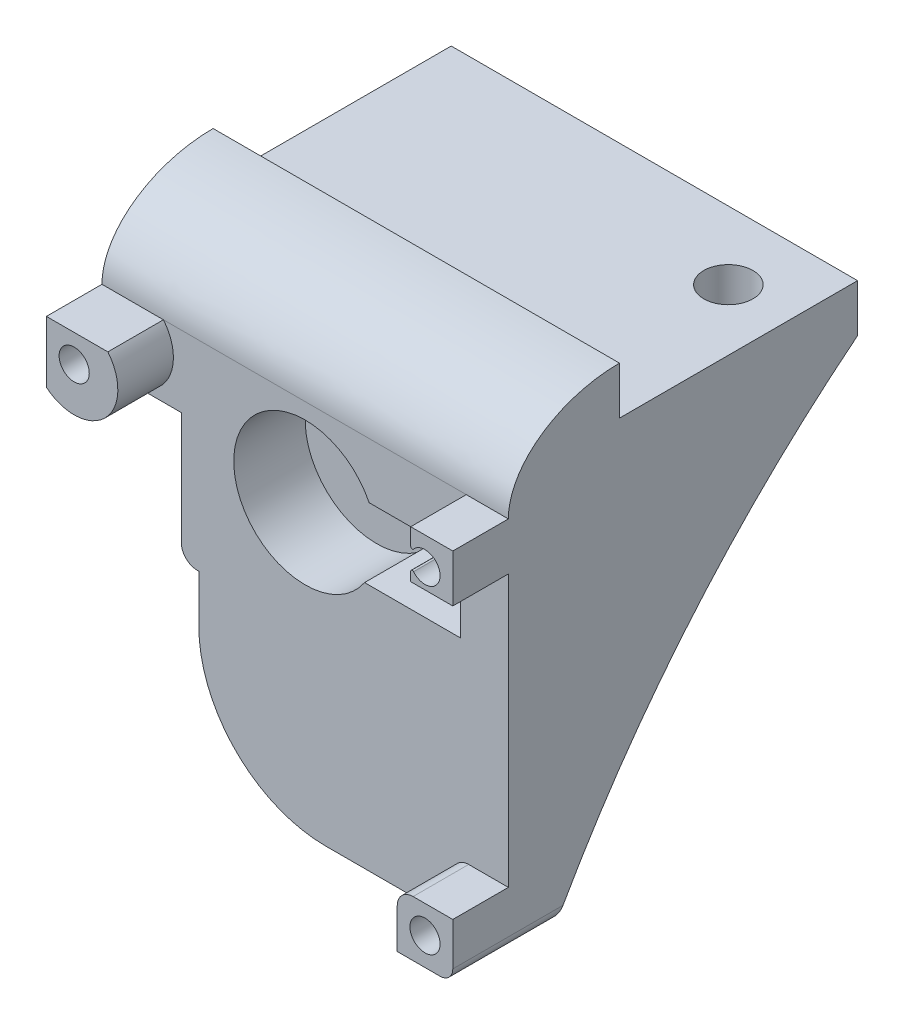
from build123d import *
from build123d.topology import SkipClean

# Parameters (mm, degrees)
BOSS_EXTRUDE1_START     = -15
BOSS_EXTRUDE1_OUTLINE_W = 25.6
BOSS_EXTRUDE1_OUTLINE_H = 3
BOSS_EXTRUDE1_DEPTH     = 15
SKETCH2_4_W             = 25.6
SKETCH2_4_H             = 6
BOSS_EXTRUDE2_DEPTH     = 4
BOSS_EXTRUDE6_START     = 4
SKETCH2_6_R             = 0.95
BOSS_EXTRUDE6_DEPTH     = 3
BOSS_EXTRUDE7_START     = 7
SKETCH2_7_R             = 0.95
BOSS_EXTRUDE7_DEPTH     = 3.5
BOSS_EXTRUDE8_START     = -25.6
BOSS_EXTRUDE8_DEPTH     = 25.6
CUT_EXTRUDE1_REACH      = 130.924
CUT_EXTRUDE1_END_RADIUS = 75
CUT_EXTRUDE2_START      = -1.5
CUT_EXTRUDE2_DEPTH      = 1.5
CUT_EXTRUDE3_REACH      = 87.887
CUT_EXTRUDE4_REACH      = 111.283
CUT_EXTRUDE4_END_RADIUS = 75
SKETCH6_R               = 1.55
CUT_EXTRUDE5_START      = -3
SKETCH6_4_R             = 1.55
CUT_EXTRUDE5_DEPTH      = 2.6
CUT_EXTRUDE6_START      = -1.098342
SKETCH7_W               = 3.1
SKETCH7_H               = 1.207100643
CUT_EXTRUDE6_DEPTH      = 1.098342


# Read off the part's stored shape, not the designer's step: Boss-Extrude1
with BuildPart() as part:
    # Boss-Extrude1 outline → Boss-Extrude1 (new body)
    with BuildSketch(Plane.XY.offset(19.065792005).offset(BOSS_EXTRUDE1_START)):
        with Locations((89.245789569, -52.366374711)):
            Rectangle(BOSS_EXTRUDE1_OUTLINE_W, BOSS_EXTRUDE1_OUTLINE_H)
    extrude(amount=BOSS_EXTRUDE1_DEPTH)

    # Sketch2<4> → Boss-Extrude2 (add)
    with BuildSketch(Plane.XY.offset(19.065792005)):
        with Locations((89.245789569, -50.866374711)):
            Rectangle(SKETCH2_4_W, SKETCH2_4_H)
    extrude(amount=BOSS_EXTRUDE2_DEPTH)

    # Sketch2<6> → Boss-Extrude6 (add)
    with BuildSketch(Plane.XY.offset(19.065792005).offset(BOSS_EXTRUDE6_START)):
        with BuildLine():
            ThreePointArc((76.445789569, -56.737695055), (77.266039857, -57.204436819), (78.195789569, -57.366374711))
            Line((78.195789569, -57.366374711), (81.445789569, -57.366374711))
            Line((81.445789569, -57.366374711), (81.445789569, -64.466374711))
            ThreePointArc((81.445789569, -64.466374711), (81.738682788, -65.173481493), (82.445789569, -65.466374711))
            Line((82.445789569, -65.466374711), (82.545789569, -65.466374711))
            Line((82.545789569, -65.466374711), (82.545789569, -68.466374711))
            ThreePointArc((82.545789569, -68.466374711), (84.88893532, -74.123228961), (90.545789569, -76.466374711))
            Line((90.545789569, -76.466374711), (101.245789569, -76.466374711))
            ThreePointArc((101.245789569, -76.466374711), (101.811474994, -76.232060136), (102.045789569, -75.666374711))
            Line((102.045789569, -75.666374711), (102.045789569, -47.866374711))
            Line((102.045789569, -47.866374711), (76.445789569, -47.866374711))
            Line((76.445789569, -47.866374711), (76.445789569, -56.737695055))
        make_face()
        with Locations(Location((100.295789569, -54.616374711, 0), (0, 0, 127.863646362))):
            Circle(SKETCH2_6_R, mode=Mode.SUBTRACT)
        with Locations(Location((78.195789569, -54.616374711, 0), (0, 0, 127.863646362))):
            Circle(SKETCH2_6_R, mode=Mode.SUBTRACT)
        with BuildLine():
            Line((99.045789569, -56.366374711), (99.045789569, -60.866374711))
            Line((99.045789569, -60.866374711), (92.987446956, -60.866374711))
            ThreePointArc((92.987446956, -60.866374711), (84.75507119, -58.077500283), (93.276918444, -56.366374711))
            Line((93.276918444, -56.366374711), (99.045789569, -56.366374711))
        make_face(mode=Mode.SUBTRACT)
        with Locations((100.295789569, -74.716374711)):
            Circle(SKETCH2_6_R, mode=Mode.SUBTRACT)
    extrude(amount=BOSS_EXTRUDE6_DEPTH)

    # Sketch2<7> → Boss-Extrude7 (add)
    # profile 1 of 6: a face of its own
    with SkipClean():  # the faces are left unmerged after this step: merging them gives an invalid solid
        with BuildSketch(Plane.XY.offset(19.065792005).offset(BOSS_EXTRUDE7_START)):
            with BuildLine():
                ThreePointArc((78.195789569, -57.366374711), (80.389530666, -56.274687107), (80.84154088, -53.866374711))
                Line((80.84154088, -53.866374711), (78.778884759, -53.866374711))
                ThreePointArc((78.778884759, -53.866374711), (79.049147768, -54.198906407), (79.145789569, -54.616374711))
                ThreePointArc((79.145789569, -54.616374711), (77.778321265, -55.46973291), (77.61269438, -53.866374711))
                Line((77.61269438, -53.866374711), (76.445789569, -53.866374711))
                Line((76.445789569, -53.866374711), (76.445789569, -56.737695055))
                ThreePointArc((76.445789569, -56.737695055), (77.266039857, -57.204436819), (78.195789569, -57.366374711))
            make_face()
        # profile 2 of 6: a face of its own
        with BuildSketch(Plane.XY.offset(19.065792005).offset(BOSS_EXTRUDE7_START)):
            with BuildLine():
                Line((78.778884759, -53.866374711), (80.84154088, -53.866374711))
                ThreePointArc((80.84154088, -53.866374711), (80.631203916, -53.339168009), (80.317109913, -52.866374711))
                Line((80.317109913, -52.866374711), (76.445789569, -52.866374711))
                Line((76.445789569, -52.866374711), (76.445789569, -53.866374711))
                Line((76.445789569, -53.866374711), (77.61269438, -53.866374711))
                ThreePointArc((77.61269438, -53.866374711), (78.195789569, -53.666374711), (78.778884759, -53.866374711))
            make_face()
        # profile 3 of 6: a face of its own
        with BuildSketch(Plane.XY.offset(19.065792005).offset(BOSS_EXTRUDE7_START)):
            with BuildLine():
                Line((102.045789569, -53.866374711), (100.878884759, -53.866374711))
                ThreePointArc((100.878884759, -53.866374711), (101.149147768, -54.198906407), (101.245789569, -54.616374711))
                ThreePointArc((101.245789569, -54.616374711), (100.62357071, -55.508035815), (99.571980046, -55.23167933))
                ThreePointArc((99.571980046, -55.23167933), (99.461286291, -55.202589173), (99.395789569, -55.296448237))
                Line((99.395789569, -55.296448237), (99.395789569, -55.866374711))
                Line((99.395789569, -55.866374711), (102.045789569, -55.866374711))
                Line((102.045789569, -55.866374711), (102.045789569, -53.866374711))
            make_face()
        # profile 4 of 6: a face of its own
        with BuildSketch(Plane.XY.offset(19.065792005).offset(BOSS_EXTRUDE7_START)):
            with BuildLine():
                Line((99.395789569, -52.866374711), (99.395789569, -53.866374711))
                Line((99.395789569, -53.866374711), (99.71269438, -53.866374711))
                ThreePointArc((99.71269438, -53.866374711), (100.295789569, -53.666374711), (100.878884759, -53.866374711))
                Line((100.878884759, -53.866374711), (102.045789569, -53.866374711))
                Line((102.045789569, -53.866374711), (102.045789569, -52.866374711))
                Line((102.045789569, -52.866374711), (99.395789569, -52.866374711))
            make_face()
        # profile 5 of 6: a face of its own
        with BuildSketch(Plane.XY.offset(19.065792005).offset(BOSS_EXTRUDE7_START)):
            with BuildLine():
                Line((99.71269438, -53.866374711), (99.395789569, -53.866374711))
                Line((99.395789569, -53.866374711), (99.395789569, -53.936301186))
                ThreePointArc((99.395789569, -53.936301186), (99.461286291, -54.03016025), (99.571980046, -54.001070093))
                ThreePointArc((99.571980046, -54.001070093), (99.638875805, -53.930106319), (99.71269438, -53.866374711))
            make_face()
        # profile 6 of 6: a face of its own
        with BuildSketch(Plane.XY.offset(19.065792005).offset(BOSS_EXTRUDE7_START)):
            with BuildLine():
                Line((102.045789569, -75.666374711), (102.045789569, -72.966374711))
                Line((102.045789569, -72.966374711), (99.545789569, -72.966374711))
                ThreePointArc((99.545789569, -72.966374711), (98.838682788, -73.25926793), (98.545789569, -73.966374711))
                Line((98.545789569, -73.966374711), (98.545789569, -76.466374711))
                Line((98.545789569, -76.466374711), (101.245789569, -76.466374711))
                ThreePointArc((101.245789569, -76.466374711), (101.811474994, -76.232060136), (102.045789569, -75.666374711))
            make_face()
            with Locations((100.295789569, -74.716374711)):
                Circle(SKETCH2_7_R, mode=Mode.SUBTRACT)
        extrude(amount=BOSS_EXTRUDE7_DEPTH)

    # Sketch3 → Boss-Extrude8 (add)
    with SkipClean():  # the faces are left unmerged after this step: merging them gives an invalid solid
        with BuildSketch(Plane.ZY.offset(-76.445789569).offset(BOSS_EXTRUDE8_START)):
            with BuildLine():
                Line((4.065792005, -53.866374711), (23.065792005, -53.866374711))
                Line((23.065792005, -53.866374711), (23.065792005, -76.466374711))
                ThreePointArc((23.065792005, -76.466374711), (14.688908487, -64.22216174), (4.065792005, -53.866374711))
            make_face()
        extrude(amount=BOSS_EXTRUDE8_DEPTH)

    # Cut-Extrude1: up to this cylinder (the profile starts outside it)
    with SkipClean():  # the faces are left unmerged after this step: merging them gives an invalid solid
        cut_extrude1_end = Plane(origin=(90.860738, -112.485393056, -42.718935079), z_dir=(-1, 0, 0)) * Cylinder(CUT_EXTRUDE1_END_RADIUS, 434.860714, mode=Mode.PRIVATE)
        # Sketch4 → Cut-Extrude1 (cut, up to the surface)
        with BuildSketch(Plane.XY.offset(23.065792005), mode=Mode.PRIVATE) as cut_extrude1_sk1:
            with BuildLine():
                ThreePointArc((76.445789569, -56.737695055), (77.266039857, -57.204436819), (78.195789569, -57.366374711))
                Line((78.195789569, -57.366374711), (81.445789569, -57.366374711))
                Line((81.445789569, -57.366374711), (81.445789569, -64.466374711))
                ThreePointArc((81.445789569, -64.466374711), (81.738682788, -65.173481493), (82.445789569, -65.466374711))
                Line((82.445789569, -65.466374711), (82.545789569, -65.466374711))
                Line((82.545789569, -65.466374711), (82.545789569, -68.466374711))
                ThreePointArc((82.545789569, -68.466374711), (84.88893532, -74.123228961), (90.545789569, -76.466374711))
                Line((90.545789569, -76.466374711), (76.445789569, -76.466374711))
                Line((76.445789569, -76.466374711), (76.445789569, -56.737695055))
            make_face()
        cut_extrude1_tool1 = extrude(cut_extrude1_sk1.sketch, amount=-CUT_EXTRUDE1_REACH, mode=Mode.PRIVATE) - cut_extrude1_end
        add(cut_extrude1_tool1.solids().sort_by_distance((79.854381, -68.162333, 23.065792))[0], mode=Mode.SUBTRACT)
        # Sketch4 → Cut-Extrude1 (cut, up to the surface)
        with BuildSketch(Plane.XY.offset(23.065792005), mode=Mode.PRIVATE) as cut_extrude1_sk2:
            with BuildLine():
                ThreePointArc((101.245789569, -76.466374711), (101.811474994, -76.232060136), (102.045789569, -75.666374711))
                Line((102.045789569, -75.666374711), (102.045789569, -76.466374711))
                Line((102.045789569, -76.466374711), (101.245789569, -76.466374711))
            make_face()
        cut_extrude1_tool2 = extrude(cut_extrude1_sk2.sketch, amount=-CUT_EXTRUDE1_REACH, mode=Mode.PRIVATE) - cut_extrude1_end
        add(cut_extrude1_tool2.solids().sort_by_distance((101.867095, -76.28768, 23.065792))[0], mode=Mode.SUBTRACT)

    # Sketch4<3> → Cut-Extrude2 (cut)
    with SkipClean():  # the faces are left unmerged after this step: merging them gives an invalid solid
        with BuildSketch(Plane.XY.offset(23.065792005).offset(CUT_EXTRUDE2_START)):
            with BuildLine():
                Line((99.045789569, -60.866374711), (99.045789569, -56.366374711))
                Line((99.045789569, -56.366374711), (93.276918444, -56.366374711))
                ThreePointArc((93.276918444, -56.366374711), (84.75507119, -58.077500283), (92.987446956, -60.866374711))
                Line((92.987446956, -60.866374711), (99.045789569, -60.866374711))
            make_face()
        extrude(amount=CUT_EXTRUDE2_DEPTH, mode=Mode.SUBTRACT)

    # Cut-Extrude3: up to this face of the body (flat: up to its plane)
    cut_extrude3_end = Plane(part.part.faces().sort_by_distance((102.045789569, -60.857452704, 17.150237261))[0])
    # Sketch5 → Cut-Extrude3 (cut, up to the picked face)
    with BuildSketch(Plane.ZY.offset(-76.445789569), mode=Mode.PRIVATE) as cut_extrude3_sk1:
        with BuildLine():
            Line((19.065792005, -47.866374711), (26.065792005, -47.866374711))
            Line((26.065792005, -47.866374711), (26.065792005, -52.866374711))
            add(Edge.make_bspline(
                [(26.065792005, -52.866374711), (26.065792005, -47.866374711), (19.065792005, -47.866374711)],
                knots=[3.141592654, 3.141592654, 3.141592654, 4.71238898, 4.71238898, 4.71238898], degree=2, weights=[1, 0.707106781, 1]))
        make_face()
    cut_extrude3_tool1 = split(extrude(cut_extrude3_sk1.sketch, amount=-CUT_EXTRUDE3_REACH, mode=Mode.PRIVATE), bisect_by=cut_extrude3_end, keep=Keep.BOTH, mode=Mode.PRIVATE)
    add(cut_extrude3_tool1.solids().sort_by(Axis((76.44579, -48.983214, 24.502216), (1, 0, 0)))[0], mode=Mode.SUBTRACT)

    # Cut-Extrude4: up to this cylinder (the profile starts outside it)
    with SkipClean():  # the faces are left unmerged after this step: merging them gives an invalid solid
        cut_extrude4_end = Plane(origin=(113.9359425, -112.485393056, -42.718935079), z_dir=(-1, 0, 0)) * Cylinder(CUT_EXTRUDE4_END_RADIUS, 405.046305, mode=Mode.PRIVATE)
        # Sketch6 → Cut-Extrude4 (cut, up to the surface)
        with BuildSketch(Plane(origin=(0, -50.866374711, 0), x_dir=(1, 0, 0), z_dir=(0, 1, 0)), mode=Mode.PRIVATE) as cut_extrude4_sk1:
            with Locations((129.676095042, -14.774895471)):
                Circle(SKETCH6_R)
        cut_extrude4_tool1 = extrude(cut_extrude4_sk1.sketch, amount=-CUT_EXTRUDE4_REACH, mode=Mode.PRIVATE) - cut_extrude4_end
        add(cut_extrude4_tool1.solids().sort_by_distance((129.676095, -50.866375, 14.774895))[0], mode=Mode.SUBTRACT)
        # Sketch6 → Cut-Extrude4 (cut, up to the surface)
        with BuildSketch(Plane(origin=(0, -50.866374711, 0), x_dir=(1, 0, 0), z_dir=(0, 1, 0)), mode=Mode.PRIVATE) as cut_extrude4_sk2:
            with Locations(Location((98.195789569, -8.356688539, 0), (0, 0, 180))):
                Circle(SKETCH6_R)
        cut_extrude4_tool2 = extrude(cut_extrude4_sk2.sketch, amount=-CUT_EXTRUDE4_REACH, mode=Mode.PRIVATE) - cut_extrude4_end
        add(cut_extrude4_tool2.solids().sort_by_distance((98.19579, -50.866375, 8.356689))[0], mode=Mode.SUBTRACT)

    # Sketch6<4> → Cut-Extrude5 (cut)
    # profile 1 of 4: a face of its own
    with SkipClean():  # the faces are left unmerged after this step: merging them gives an invalid solid
        with BuildSketch(Plane(origin=(0, -50.866374711, 0), x_dir=(1, 0, 0), z_dir=(0, 1, 0)).offset(CUT_EXTRUDE5_START)):
            Polygon((132.526095042, -13.129447203), (129.676095042, -11.483998936), (126.826095042, -13.129447203), (126.826095042, -16.420343738), (129.676095042, -18.065792005), (132.526095042, -16.420343738), align=None)
            with Locations((129.676095042, -14.774895471)):
                Circle(SKETCH6_4_R, mode=Mode.SUBTRACT)
        # profile 2 of 4: a face of its own
        with BuildSketch(Plane(origin=(0, -50.866374711, 0), x_dir=(1, 0, 0), z_dir=(0, 1, 0)).offset(CUT_EXTRUDE5_START)):
            Polygon((126.826095042, -13.129447203), (129.676095042, -11.483998936), (132.526095042, -13.129447203), (132.526095042, -4.065792005), (126.826095042, -4.065792005), align=None)
        # profile 3 of 4: a face of its own
        with BuildSketch(Plane(origin=(0, -50.866374711, 0), x_dir=(1, 0, 0), z_dir=(0, 1, 0)).offset(CUT_EXTRUDE5_START)):
            Polygon((101.045789569, -6.711240272), (98.195789569, -5.065792005), (95.345789569, -6.711240272), (95.345789569, -10.002136807), (98.195789569, -11.647585074), (101.045789569, -10.002136807), align=None)
            with Locations(Location((98.195789569, -8.356688539, 0), (0, 0, 180))):
                Circle(SKETCH6_4_R, mode=Mode.SUBTRACT)
        # profile 4 of 4: a face of its own
        with BuildSketch(Plane(origin=(0, -50.866374711, 0), x_dir=(1, 0, 0), z_dir=(0, 1, 0)).offset(CUT_EXTRUDE5_START)):
            Polygon((95.345789569, -6.711240272), (98.195789569, -5.065792005), (101.045789569, -6.711240272), (101.045789569, -4.065792005), (95.345789569, -4.065792005), align=None)
        extrude(amount=-CUT_EXTRUDE5_DEPTH, mode=Mode.SUBTRACT)

    # Sketch7 → Cut-Extrude6 (cut)
    with SkipClean():  # the faces are left unmerged after this step: merging them gives an invalid solid
        with BuildSketch(Plane(origin=(0, -56.466374711, 0), x_dir=(1, 0, 0), z_dir=(0, 1, 0)).offset(CUT_EXTRUDE6_START)):
            with Locations((98.195789569, -7.753138218)):
                Rectangle(SKETCH7_W, SKETCH7_H)
        extrude(amount=CUT_EXTRUDE6_DEPTH, mode=Mode.SUBTRACT)


solid = part.part
